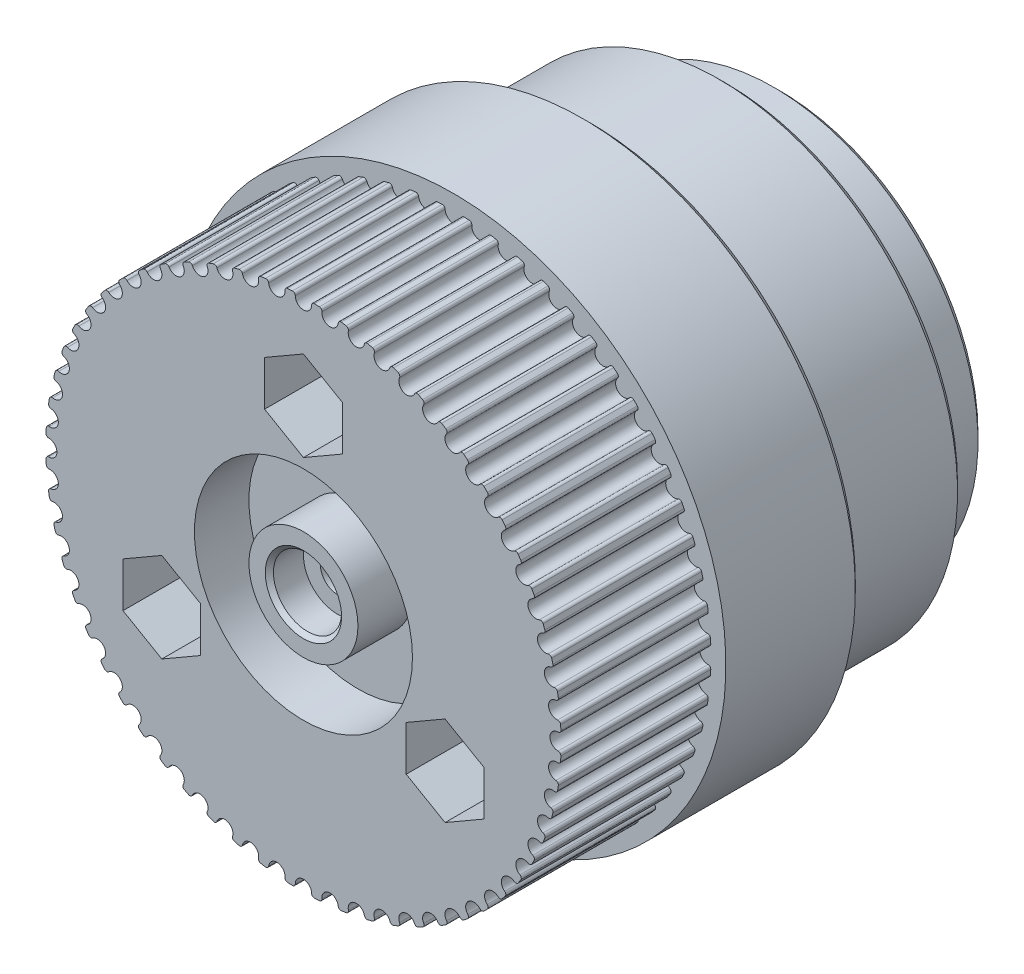
from build123d import *

# Parameters (mm, degrees)
SKETCHREVOLVEGEARBELT02_W       = 11
SKETCHREVOLVEGEARBELT02_H       = 18.908092887
TOOTHEXTRUDECUTGEARBELT02_DEPTH = 11
PATTERNGEARBELT02_COUNT         = 60
SKETCH_2_R                      = 20
EXTRUDE_1_DEPTH                 = 10
SKETCH_3_R                      = 17.5
EXTRUDE_2_DEPTH                 = 10
SKETCH_4_R                      = 15
EXTRUDE_3_DEPTH                 = 4
SKETCH_5_R                      = 1.75
CUT_EXTRUDE_1_DEPTH             = 46
CUT_EXTRUDE_2_DEPTH             = 20
PATTERN_CIRCULAR_1_COUNT        = 3
CHAMFER1_SIZE                   = 0.5
SKETCH_7_R                      = 2.5
CUT_EXTRUDE_3_DEPTH             = 2.5
CHAMFER_1_SIZE                  = 0.3
CUT_EXTRUDE_4_DEPTH             = 46
CUT_EXTRUDE_4_DEPTH_BACK        = 46
SKETCH_8_R                      = 1.25
SKETCH_10_R                     = 8
SKETCH_10_R_2                   = 4
CUT_EXTRUDE_5_DEPTH             = 4


with BuildPart() as part:
    # SketchRevolveGearBelt02 → GearBelt02 (revolve)
    with BuildSketch(Plane(origin=(0, 0, 0), x_dir=(0, 0, -1), z_dir=(1, 0, 0))):
        with Locations((5.5, 9.454046444)):
            Rectangle(SKETCHREVOLVEGEARBELT02_W, SKETCHREVOLVEGEARBELT02_H)
    revolve(axis=Axis((0, 0, 0), (0, 0, -1)))

    # SketchToothGearBelt02 → ToothExtrudeCutGearBelt02 (cut)
    with BuildSketch(Plane.XY):
        with BuildLine():
            Line((-0.810458232, 18.890715552), (0, 21.448092849))
            Line((0, 21.448092849), (0.810458232, 18.890715552))
            ThreePointArc((0.810458232, 18.890715552), (0.662199993, 18.834818977), (0.599999991, 18.68909289))
            ThreePointArc((0.599999991, 18.68909289), (0, 18.089092899), (-0.599999991, 18.68909289))
            ThreePointArc((-0.599999991, 18.68909289), (-0.662199993, 18.834818977), (-0.810458232, 18.890715552))
        make_face()
    toothextrudecutgearbelt02 = extrude(amount=-TOOTHEXTRUDECUTGEARBELT02_DEPTH, mode=Mode.SUBTRACT)

    # PatternGearBelt02: ToothExtrudeCutGearBelt02 ×60 about axis
    patterngearbelt02_axis = Axis((0, 0, 55), (0, 0, -1))
    for i in range(1, PATTERNGEARBELT02_COUNT):
        add(toothextrudecutgearbelt02.rotate(patterngearbelt02_axis, i * 360 / PATTERNGEARBELT02_COUNT), mode=Mode.SUBTRACT)

    # Эскиз2 → Бобышка-Вытянуть1 (add)
    with BuildSketch(Plane(origin=(0, 0, -11), x_dir=(-1, 0, 0), z_dir=(0, 0, -1))):
        Circle(SKETCH_2_R)
    extrude(amount=EXTRUDE_1_DEPTH)

    # Эскиз3 → Бобышка-Вытянуть2 (add)
    with BuildSketch(Plane(origin=(0, 0, -21), x_dir=(-1, 0, 0), z_dir=(0, 0, -1))):
        Circle(SKETCH_3_R)
    extrude(amount=EXTRUDE_2_DEPTH)

    # Эскиз4 → Бобышка-Вытянуть3 (add)
    with BuildSketch(Plane(origin=(0, 0, -31), x_dir=(-1, 0, 0), z_dir=(0, 0, -1))):
        Circle(SKETCH_4_R)
    extrude(amount=EXTRUDE_3_DEPTH)

    # Эскиз5 → Вырез-Вытянуть1 (cut, through all)
    with BuildSketch(Plane.XY):
        with Locations((0, 12)):
            Circle(SKETCH_5_R)
        with Locations((10.392304845, -6)):
            Circle(SKETCH_5_R)
        with Locations((-10.392304845, -6)):
            Circle(SKETCH_5_R)
    extrude(amount=-CUT_EXTRUDE_1_DEPTH, mode=Mode.SUBTRACT)

    # Эскиз6 → Вырез-Вытянуть2 (cut)
    with BuildSketch(Plane.XY):
        Polygon((0, 8.709103466), (2.85, 10.354551733), (2.85, 13.645448267), (0, 15.290896534), (-2.85, 13.645448267), (-2.85, 10.354551733), align=None)
    cut_extrude_2 = extrude(amount=-CUT_EXTRUDE_2_DEPTH, mode=Mode.SUBTRACT)

    # Круговой массив1: Вырез-Вытянуть2 ×3 about axis
    pattern_circular_1_axis = Axis((0, 0, -21), (0, 0, 1))
    for i in range(1, PATTERN_CIRCULAR_1_COUNT):
        add(cut_extrude_2.rotate(pattern_circular_1_axis, i * 360 / PATTERN_CIRCULAR_1_COUNT), mode=Mode.SUBTRACT)

    # Chamfer1
    chamfer1_edges = [part.edges().sort_by_distance(p)[0] for p in [
        (20, 0, -21),
        (15, 0, -35),
        (17.5, 0, -31),
    ]]
    chamfer(chamfer1_edges, length=CHAMFER1_SIZE)

    # Эскиз7 → Вырез-Вытянуть3 (cut)
    with BuildSketch(Plane.XY):
        Circle(SKETCH_7_R)
    extrude(amount=-CUT_EXTRUDE_3_DEPTH, mode=Mode.SUBTRACT)

    # Фаска1
    chamfer_1_edges = [part.edges().sort_by_distance(p)[0] for p in [
        (-2.5, 0, 0),
    ]]
    chamfer(chamfer_1_edges, length=CHAMFER_1_SIZE)

    # Эскиз8 → Вырез-Вытянуть4 (cut, two sides: drawn at the far end of the back side and taken through both)
    with BuildSketch(Plane.XY.offset(-CUT_EXTRUDE_4_DEPTH_BACK)):
        Circle(SKETCH_8_R)
    extrude(amount=CUT_EXTRUDE_4_DEPTH + CUT_EXTRUDE_4_DEPTH_BACK, mode=Mode.SUBTRACT)

    # Эскиз10 → Вырез-Вытянуть5 (cut)
    with BuildSketch(Plane.XY):
        Circle(SKETCH_10_R)
        Circle(SKETCH_10_R_2, mode=Mode.SUBTRACT)
    extrude(amount=-CUT_EXTRUDE_5_DEPTH, mode=Mode.SUBTRACT)


solid = part.part
